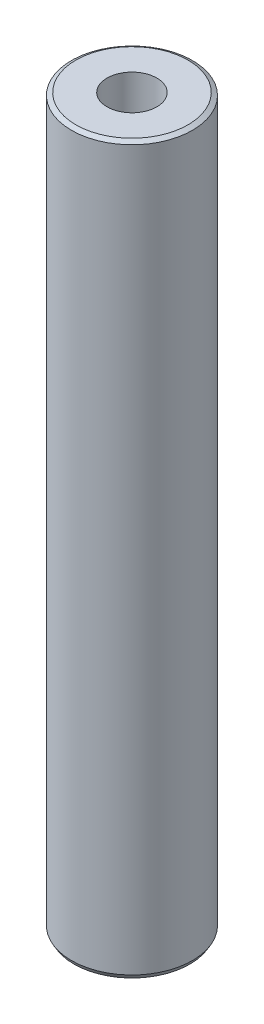
from build123d import *
from OCP.BRepFilletAPI import BRepFilletAPI_MakeChamfer

# Parameters (mm, degrees)
SKETCH1_R           = 50
BOSS_EXTRUDE1_DEPTH = 600
SKETCH2_R           = 20.619398935
CUT_EXTRUDE1_DEPTH  = 605.15229868
CHAMFER1_SIZE       = 2.10564541
CHAMFER1_SIZE2      = 3.647084833


with BuildPart() as part:
    # Sketch1 → Boss-Extrude1 (new body)
    with BuildSketch(Plane(origin=(0, 0, 0), x_dir=(1, 0, 0), z_dir=(0, 1, 0))):
        Circle(SKETCH1_R)
    extrude(amount=BOSS_EXTRUDE1_DEPTH)

    # Sketch2 → Cut-Extrude1 (cut, through all)
    with BuildSketch(Plane(origin=(0, 0, 0), x_dir=(1, 0, 0), z_dir=(0, 1, 0))):
        Circle(SKETCH2_R)
    extrude(amount=CUT_EXTRUDE1_DEPTH, mode=Mode.SUBTRACT)

    # Chamfer1: one chamfer whose edges measure the first distance from different faces: ONE call of the kernel's chamfer builder (chamfer() names one face for all edges)
    chamfer1_edges_1 = [part.edges().sort_by_distance(p)[0] for p in [
        (-50, 600, 0),
    ]]
    chamfer1_side_1 = [part.faces().sort_by_distance(p)[0] for p in [
        (-50, 300, 0),
    ]]
    chamfer1_edges_2 = [part.edges().sort_by_distance(p)[0] for p in [
        (-50, 0, 0),
    ]]
    chamfer1_side_2 = [part.faces().sort_by_distance(p)[0] for p in [
        (-48.585786438, 0, 0),
    ]]
    chamfer1 = BRepFilletAPI_MakeChamfer(part.part.solid().wrapped)
    for e in chamfer1_edges_1:
        chamfer1.Add(CHAMFER1_SIZE, CHAMFER1_SIZE2, e.wrapped, chamfer1_side_1[0].wrapped)  # the first distance lies on this face
    for e in chamfer1_edges_2:
        chamfer1.Add(CHAMFER1_SIZE, CHAMFER1_SIZE2, e.wrapped, chamfer1_side_2[0].wrapped)  # the first distance lies on this face
    add(Compound.cast(chamfer1.Shape()), mode=Mode.REPLACE)


solid = part.part
